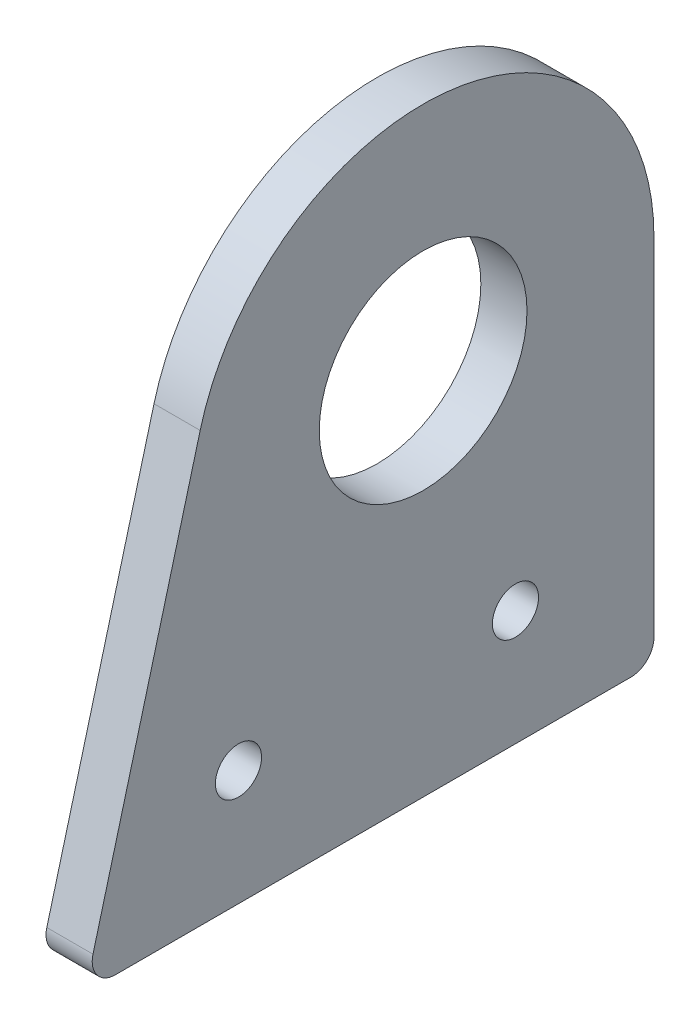
from build123d import *

# Parameters (mm, degrees)
SKETCH2_R           = 14.2875
SKETCH2_R_2         = 3.175
BOSS_EXTRUDE1_DEPTH = 6.35


with BuildPart() as part:
    # Sketch2 → Boss-Extrude1 (new body)
    with BuildSketch(Plane(origin=(0, 0, 0), x_dir=(0, 0, -1), z_dir=(1, 0, 0))):
        with BuildLine():
            Line((-30.668144985, 154.267504682), (-45.22073508, 99.956499064))
            Line((-45.22073508, 99.956499064), (-45.410911643, 99.246750468))
            ThreePointArc((-45.410911643, 99.246750468), (-44.862994, 96.492182463), (-42.344097145, 95.25))
            Line((-42.344097145, 95.25), (28.575, 95.25))
            ThreePointArc((28.575, 95.25), (30.82006403, 96.17993597), (31.75, 98.425))
            Line((31.75, 98.425), (31.75, 110.608066701))
            Line((31.75, 110.608066701), (31.75, 146.05))
            ThreePointArc((31.75, 146.05), (4.144206603, 177.528374349), (-30.668144985, 154.267504682))
        make_face()
        with Locations((0, 146.05)):
            Circle(SKETCH2_R, mode=Mode.SUBTRACT)
        with Locations((-25.4, 111.125)):
            Circle(SKETCH2_R_2, mode=Mode.SUBTRACT)
        with Locations((12.7, 111.125)):
            Circle(SKETCH2_R_2, mode=Mode.SUBTRACT)
    extrude(amount=BOSS_EXTRUDE1_DEPTH)


solid = part.part
